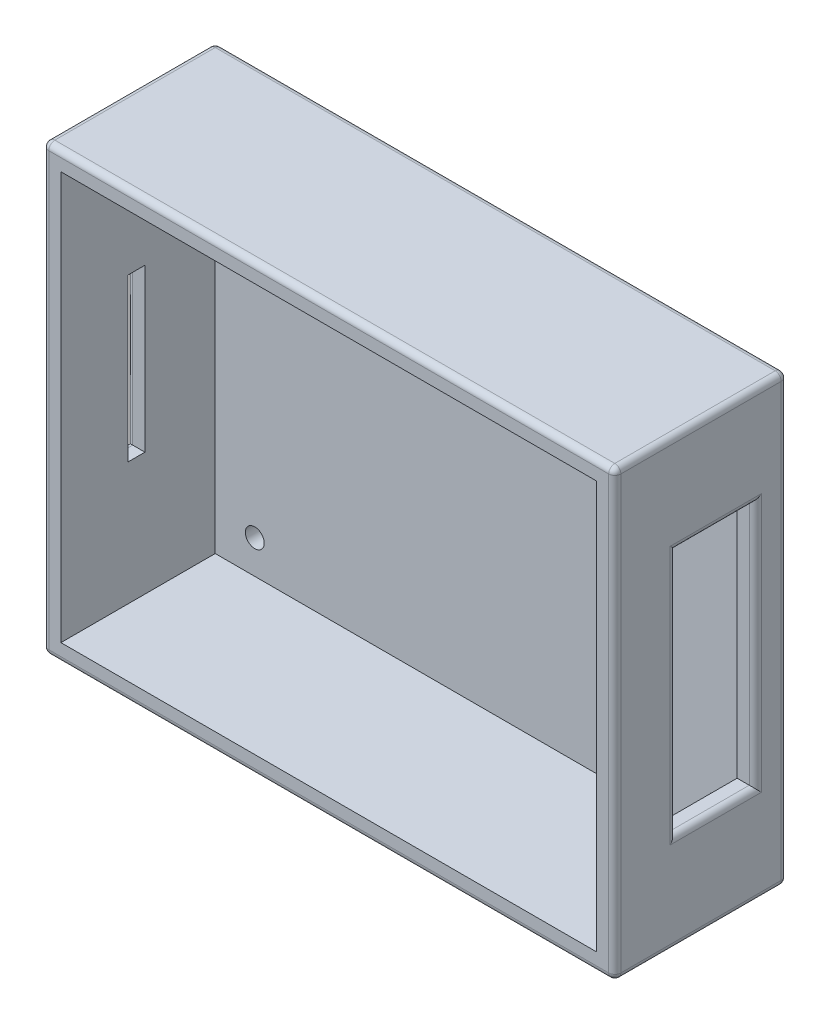
from build123d import *

# Parameters (mm, degrees)
SKETCH_1_W          = 94
SKETCH_1_H          = 73
SKETCH_1_R          = 1.55
EXTRUDE_2_DEPTH     = 28.35
SKETCH_3_W          = 88
SKETCH_3_H          = 67
CUT_EXTRUDE_1_DEPTH = 25.35
SKETCH_4_W          = 13
SKETCH_4_H          = 40.5
CUT_EXTRUDE_3_DEPTH = 3
CHAMFER_1_SIZE      = 2
SKETCH_6_W          = 2.8
SKETCH_6_H          = 26.6
CUT_EXTRUDE_4_DEPTH = 3
FILLET_1_R          = 1
EXTRUDE_3_DEPTH     = 0.8


with BuildPart() as part:
    # Эскиз1 → Бобышка-Вытянуть2 (new body)
    with BuildSketch(Plane.XY):
        with Locations((-0.5, -44.96449166)):
            Rectangle(SKETCH_1_W, SKETCH_1_H)
        with Locations(Location((-38, -16.96449166, 0), (0, 0, 180))):
            Circle(SKETCH_1_R, mode=Mode.SUBTRACT)
        with Locations(Location((38, -16.96449166, 0), (0, 0, 180))):
            Circle(SKETCH_1_R, mode=Mode.SUBTRACT)
        with Locations(Location((38, -72.96449166, 0), (0, 0, 180))):
            Circle(SKETCH_1_R, mode=Mode.SUBTRACT)
        with Locations(Location((-38, -72.96449166, 0), (0, 0, 180))):
            Circle(SKETCH_1_R, mode=Mode.SUBTRACT)
    extrude(amount=EXTRUDE_2_DEPTH)

    # Эскиз3 → Вырез-Вытянуть1 (cut)
    with BuildSketch(Plane.XY.offset(28.35)):
        with Locations((-0.5, -44.96449166)):
            Rectangle(SKETCH_3_W, SKETCH_3_H)
    extrude(amount=-CUT_EXTRUDE_1_DEPTH, mode=Mode.SUBTRACT)

    # Эскиз4 → Вырез-Вытянуть3 (cut)
    with BuildSketch(Plane(origin=(46.5, 0, 0), x_dir=(0, 0, -1), z_dir=(1, 0, 0))):
        with Locations((-11.75, -45.056943797)):
            Rectangle(SKETCH_4_W, SKETCH_4_H)
    extrude(amount=-CUT_EXTRUDE_3_DEPTH, mode=Mode.SUBTRACT)

    # Фаска1
    chamfer_1_edges = [part.edges().sort_by_distance(p)[0] for p in [
        (43.5, -45.056943797, 18.25),
    ]]
    chamfer(chamfer_1_edges, length=CHAMFER_1_SIZE)

    # Эскиз6 → Вырез-Вытянуть4 (cut)
    with BuildSketch(Plane.ZY.offset(47.5)):
        with Locations((15.95, -44.96449166)):
            Rectangle(SKETCH_6_W, SKETCH_6_H)
    extrude(amount=-CUT_EXTRUDE_4_DEPTH, mode=Mode.SUBTRACT)

    # Скругление1
    fillet_1_edges = [part.edges().sort_by_distance(p)[0] for p in [
        (46.5, -8.46449166, 14.175),
        (46.5, -44.96449166, 28.35),
        (-0.5, -8.46449166, 28.35),
        (-47.5, -44.96449166, 28.35),
        (-0.5, -81.46449166, 28.35),
        (46.5, -24.806943797, 11.75),
        (46.5, -45.056943797, 18.25),
        (46.5, -65.306943797, 11.75),
        (46.5, -45.056943797, 5.25),
        (-0.5, -8.46449166, 0),
        (46.5, -44.96449166, 0),
        (46.5, -81.46449166, 14.175),
        (-0.5, -81.46449166, 0),
        (-47.5, -44.96449166, 0),
        (-47.5, -81.46449166, 14.175),
        (-47.5, -44.96449166, 14.55),
        (-47.5, -44.96449166, 17.35),
        (-47.5, -58.26449166, 15.95),
        (-47.5, -31.66449166, 15.95),
        (-47.5, -8.46449166, 14.175),
    ]]
    fillet(fillet_1_edges, radius=FILLET_1_R - 0.0001)  # a hair under: the kernel refuses the full size

    # Эскиз7 → Бобышка-Вытянуть3 (add)
    # profile 1 of 7: a face of its own
    with BuildSketch(Plane.XZ.offset(81.46449166)):
        with BuildLine():
            Line((-25.998738266, 13.421980691), (-24.57628484, 13.580031071))
            Line((-24.57628484, 13.580031071), (-24.593571601, 13.170087897))
            add(Edge.make_bspline(
                [(-24.593571601, 13.170087897), (-24.58918248, 13.058659708), (-24.580492643, 12.83804768), (-24.51479641, 12.515351956), (-24.406526654, 12.207746813), (-24.259983953, 11.914341954), (-24.060535711, 11.642574177), (-23.79948073, 11.406277945), (-23.485459325, 11.200606133), (-23.117333989, 11.032791449), (-22.705690078, 10.89788566), (-22.253564966, 10.802909353), (-21.764933146, 10.746144699), (-21.426960447, 10.738879207), (-21.252287773, 10.73512422)],
                knots=[0, 0, 0, 0, 0.858275681, 1.699264264, 2.525822281, 3.365565876, 4.218149606, 5.107011874, 6.064126396, 7.09998594, 8.215326971, 9.396056326, 10.654217318, 12, 12, 12, 12], degree=3))
            add(Edge.make_bspline(
                [(-21.252287773, 10.73512422), (-21.127925054, 10.736901677), (-20.886236266, 10.740356018), (-20.53485233, 10.770427799), (-20.206316547, 10.818800357), (-19.900607884, 10.887566076), (-19.61851522, 10.977011888), (-19.356718314, 11.082040218), (-19.11886263, 11.210385148), (-18.906509644, 11.359797369), (-18.717818175, 11.519862543), (-18.549850471, 11.684494112), (-18.412249365, 11.858529972), (-18.295768978, 12.035122406), (-18.206235982, 12.219431388), (-18.141752542, 12.40926719), (-18.103145853, 12.605473994), (-18.098544583, 12.737748635), (-18.096219235, 12.804596392)],
                knots=[0, 0, 0, 0, 1.425731279, 2.770792289, 4.04024254, 5.230893421, 6.3592722, 7.430212247, 8.460708778, 9.450459374, 10.401561135, 11.295891975, 12.14200498, 12.940503131, 13.717227411, 14.484314755, 15.234016756, 16, 16, 16, 16], degree=3))
            add(Edge.make_bspline(
                [(-18.096219235, 12.804596392), (-18.101384398, 12.897433587), (-18.111631468, 13.081611548), (-18.196728876, 13.349146236), (-18.327590265, 13.6063769), (-18.453515737, 13.756770317), (-18.518510096, 13.834393403)],
                knots=[0, 0, 0, 0, 0.976847459, 1.937949255, 2.935706458, 4, 4, 4, 4], degree=3))
            add(Edge.make_bspline(
                [(-18.518510096, 13.834393403), (-18.561335789, 13.875664553), (-18.657559858, 13.968395754), (-18.838058598, 14.09923587), (-19.063528076, 14.241996301), (-19.336100961, 14.39427283), (-19.654621195, 14.556148143), (-20.019682532, 14.729302882), (-20.430539491, 14.913738211), (-20.721905424, 15.036824685), (-20.874448582, 15.101265985)],
                knots=[0, 0, 0, 0, 0.53058602, 1.192161577, 1.98540538, 2.9135926, 3.978754358, 5.17558752, 6.521293165, 8, 8, 8, 8], degree=3))
            add(Edge.make_bspline(
                [(-20.874448582, 15.101265985), (-20.993997425, 15.151043715), (-21.223814361, 15.246734859), (-21.552021246, 15.391612868), (-21.853248079, 15.522330729), (-22.121545791, 15.650357228), (-22.362753903, 15.762219172), (-22.571879112, 15.869252373), (-22.753579921, 15.96401851), (-22.861875919, 16.029328585), (-22.91181677, 16.059446417)],
                knots=[0, 0, 0, 0, 1.379339666, 2.651599208, 3.821445283, 4.876640935, 5.817965058, 6.653218182, 7.378929685, 8, 8, 8, 8], degree=3))
            add(Edge.make_bspline(
                [(-22.91181677, 16.059446417), (-23.047460541, 16.148591382), (-23.308158276, 16.319921699), (-23.648139477, 16.616282305), (-23.943603194, 16.912609276), (-24.176088697, 17.23170026), (-24.357630821, 17.565899905), (-24.484095739, 17.922468312), (-24.563539845, 18.300737084), (-24.571981542, 18.561509468), (-24.57628484, 18.694442606)],
                knots=[0, 0, 0, 0, 1.190296613, 2.28766591, 3.304920813, 4.256269293, 5.175634749, 6.087520294, 7.025081087, 8, 8, 8, 8], degree=3))
            add(Edge.make_bspline(
                [(-24.57628484, 18.694442606), (-24.570117834, 18.848037406), (-24.557963109, 19.150761681), (-24.46117021, 19.59319029), (-24.301954406, 20.011666174), (-24.117450126, 20.337966712), (-23.94184151, 20.583005826), (-23.793275735, 20.75674832), (-23.627870217, 20.917289288), (-23.452166479, 21.071549952), (-23.257194536, 21.208301526), (-23.051981782, 21.339250356), (-22.829070739, 21.45312929), (-22.513802014, 21.597017424), (-22.09133403, 21.742211093), (-21.556242759, 21.868234618), (-20.989349793, 21.943251386), (-20.60138023, 21.952147206), (-20.402766977, 21.956701244)],
                knots=[0, 0, 0, 0, 1.238475896, 2.440946701, 3.635078099, 4.839601842, 5.453463916, 6.065850834, 6.681148677, 7.312269075, 7.950065238, 8.600634686, 9.275045789, 9.967691431, 11.396165333, 12.870345012, 14.397835766, 16, 16, 16, 16], degree=3))
            add(Edge.make_bspline(
                [(-20.402766977, 21.956701244), (-20.283352448, 21.955610763), (-20.050014613, 21.953479946), (-19.707282282, 21.927078529), (-19.378119472, 21.889017023), (-19.063315443, 21.831914476), (-18.761927252, 21.760797616), (-18.476049696, 21.671407), (-18.202935712, 21.568670017), (-17.94655436, 21.446619385), (-17.705010247, 21.31372266), (-17.478781074, 21.170754856), (-17.271385246, 21.014697631), (-17.080563872, 20.849012453), (-16.906140591, 20.673183015), (-16.750854988, 20.484970712), (-16.611615629, 20.287040068), (-16.453764599, 20.013159969), (-16.292701843, 19.668073859), (-16.150043943, 19.254460254), (-16.056984902, 18.850056191), (-16.046626827, 18.581309258), (-16.041564287, 18.449958424)],
                knots=[0, 0, 0, 0, 1.143512507, 2.234441106, 3.290654609, 4.316047515, 5.297102877, 6.254749841, 7.183126598, 8.089581974, 8.971812638, 9.822656227, 10.650539834, 11.455310542, 12.241441721, 13.019784509, 13.789735541, 14.55649065, 16.045011508, 17.428866519, 18.743351145, 20, 20, 20, 20], degree=3))
            add(Edge.make_bspline(
                [(-16.041564287, 18.449958424), (-16.041564287, 18.415384903), (-16.041564287, 18.32977428), (-16.041564287, 18.244163658), (-16.041564287, 18.193126555)],
                knots=[0, 0, 0, 0, 0.807692308, 2, 2, 2, 2], degree=3))
            Line((-16.041564287, 18.193126555), (-17.464017713, 18.064710621))
            add(Edge.make_bspline(
                [(-17.464017713, 18.064710621), (-17.464627259, 18.147073655), (-17.465780867, 18.302951469), (-17.483136998, 18.522316963), (-17.510013039, 18.713857327), (-17.542718168, 18.828875729), (-17.557860126, 18.882127433)],
                knots=[0, 0, 0, 0, 1.196373472, 2.264220624, 3.196361544, 4, 4, 4, 4], degree=3))
            add(Edge.make_bspline(
                [(-17.557860126, 18.882127433), (-17.58795316, 18.9652977), (-17.647269929, 19.129235695), (-17.769632787, 19.356943891), (-17.915066898, 19.5638303), (-18.080951829, 19.755318654), (-18.28057915, 19.923940028), (-18.508645928, 20.078777623), (-18.773576352, 20.210948322), (-19.067856831, 20.325521016), (-19.388177693, 20.419754606), (-19.729881776, 20.484249203), (-20.08959815, 20.529071958), (-20.335943709, 20.532495484), (-20.46203587, 20.534247818)],
                knots=[0, 0, 0, 0, 0.88689608, 1.748172411, 2.584840347, 3.421997753, 4.283274084, 5.199961756, 6.182923366, 7.247800225, 8.366915099, 9.5288022, 10.735115532, 12, 12, 12, 12], degree=3))
            add(Edge.make_bspline(
                [(-20.46203587, 20.534247818), (-20.572390792, 20.53221196), (-20.786860586, 20.528255361), (-21.09890774, 20.501709026), (-21.391686188, 20.454318649), (-21.665928814, 20.390857006), (-21.922543812, 20.30957854), (-22.160164017, 20.208498659), (-22.379173408, 20.08809363), (-22.511044533, 19.991552153), (-22.575959711, 19.944028428)],
                knots=[0, 0, 0, 0, 1.185078943, 2.303147281, 3.3596952, 4.367486573, 5.323590023, 6.246379327, 7.136758724, 8, 8, 8, 8], degree=3))
            add(Edge.make_bspline(
                [(-22.575959711, 19.944028428), (-22.622350702, 19.906523912), (-22.713213968, 19.833066056), (-22.829001838, 19.703807004), (-22.932710469, 19.569938914), (-23.009850151, 19.421168344), (-23.076765117, 19.267919253), (-23.119884044, 19.102947613), (-23.147896722, 18.930006401), (-23.151832675, 18.811447871), (-23.153831415, 18.751241962)],
                knots=[0, 0, 0, 0, 1.039030166, 2.035086348, 3.020315512, 3.984274806, 4.949837582, 5.932341348, 6.950010026, 8, 8, 8, 8], degree=3))
            add(Edge.make_bspline(
                [(-23.153831415, 18.751241962), (-23.151136676, 18.679378661), (-23.145847757, 18.538333776), (-23.099376353, 18.332665481), (-23.025062696, 18.138582454), (-22.918999716, 17.952705724), (-22.769774922, 17.775623557), (-22.574700755, 17.60414871), (-22.333476283, 17.433420049), (-22.151442263, 17.331166053), (-22.054887362, 17.276928255)],
                knots=[0, 0, 0, 0, 0.885166844, 1.737301987, 2.585559362, 3.440410528, 4.36313212, 5.426921844, 6.635181999, 8, 8, 8, 8], degree=3))
            add(Edge.make_bspline(
                [(-22.054887362, 17.276928255), (-22.011268002, 17.254686863), (-21.91189615, 17.204017426), (-21.745034978, 17.119463092), (-21.537857896, 17.024361744), (-21.294850319, 16.909172326), (-21.010332094, 16.786370877), (-20.692193773, 16.640113727), (-20.332560365, 16.486387037), (-20.080826974, 16.376544037), (-19.948372133, 16.318747823)],
                knots=[0, 0, 0, 0, 0.507694923, 1.156609942, 1.939357829, 2.871124938, 3.94489054, 5.152129338, 6.501532703, 8, 8, 8, 8], degree=3))
            add(Edge.make_bspline(
                [(-19.948372133, 16.318747823), (-19.840535325, 16.271004969), (-19.632962827, 16.17910589), (-19.334132068, 16.046776814), (-19.06236467, 15.920976288), (-18.817273283, 15.801920879), (-18.597728014, 15.691804463), (-18.404475309, 15.587575431), (-18.237096138, 15.49237928), (-18.135559477, 15.429178487), (-18.088810624, 15.400079986)],
                knots=[0, 0, 0, 0, 1.363402043, 2.62438005, 3.778247165, 4.825290736, 5.77437896, 6.617445503, 7.363453188, 8, 8, 8, 8], degree=3))
            add(Edge.make_bspline(
                [(-18.088810624, 15.400079986), (-17.979831919, 15.325240033), (-17.766027205, 15.178411946), (-17.484093817, 14.918555587), (-17.238777486, 14.638113987), (-17.03518289, 14.332731213), (-16.873447416, 14.005020688), (-16.75629796, 13.655661933), (-16.685266045, 13.284099911), (-16.677653662, 13.02881818), (-16.67376581, 12.898438805)],
                knots=[0, 0, 0, 0, 1.054714124, 2.069237773, 3.052629045, 4.024524991, 4.991873927, 5.962790947, 6.959541516, 8, 8, 8, 8], degree=3))
            add(Edge.make_bspline(
                [(-16.67376581, 12.898438805), (-16.67583304, 12.816053576), (-16.679916722, 12.653306735), (-16.707470336, 12.411178635), (-16.754830671, 12.175310189), (-16.818311382, 11.942359987), (-16.906792327, 11.716898214), (-17.00696482, 11.492765183), (-17.128944419, 11.274986603), (-17.269253162, 11.06429311), (-17.425002555, 10.86040772), (-17.597768805, 10.66905719), (-17.783371924, 10.488409003), (-17.981941239, 10.31863658), (-18.197223218, 10.163461807), (-18.427697525, 10.02113552), (-18.669936656, 9.886532058), (-19.014680659, 9.724907522), (-19.475406534, 9.556868227), (-20.063335125, 9.4141754), (-20.690084109, 9.329838905), (-21.12031729, 9.318494701), (-21.341191112, 9.312670795)],
                knots=[0, 0, 0, 0, 0.753323331, 1.488142895, 2.22477222, 2.951645461, 3.692569589, 4.437003057, 5.195162042, 5.9717794, 6.750145735, 7.539032231, 8.32684067, 9.11716229, 9.925698599, 10.750710093, 11.592951182, 12.45831893, 14.230046657, 16.066640586, 17.980685438, 20, 20, 20, 20], degree=3))
            add(Edge.make_bspline(
                [(-21.341191112, 9.312670795), (-21.508395537, 9.315524732), (-21.835113548, 9.321101334), (-22.313397032, 9.364379083), (-22.76934704, 9.431519267), (-23.201043581, 9.531906041), (-23.611689323, 9.652414479), (-23.994780351, 9.81098295), (-24.357431001, 9.990027725), (-24.695760685, 10.19902915), (-25.002920921, 10.446309146), (-25.270954117, 10.7395702), (-25.496758859, 11.078689324), (-25.67874481, 11.462977463), (-25.822413596, 11.889861113), (-25.924642124, 12.361001264), (-25.986007184, 12.877073402), (-25.994387609, 13.235766784), (-25.998738266, 13.421980691)],
                knots=[0, 0, 0, 0, 1.125067994, 2.198386657, 3.229442192, 4.223907366, 5.179018808, 6.105903256, 7.010179201, 7.898637484, 8.776811776, 9.655143314, 10.561656395, 11.508166035, 12.508477435, 13.586446658, 14.74701564, 16, 16, 16, 16], degree=3))
        make_face()
    # profile 2 of 7: a face of its own
    with BuildSketch(Plane.XZ.offset(81.46449166)):
        with BuildLine():
            Line((-15.251312384, 9.470721176), (-12.722506295, 21.798650863))
            Line((-12.722506295, 21.798650863), (-9.03548726, 21.798650863))
            add(Edge.make_bspline(
                [(-9.03548726, 21.798650863), (-8.928464532, 21.798427102), (-8.720131306, 21.797991521), (-8.417976135, 21.787471392), (-8.134757118, 21.772674565), (-7.871901857, 21.754065194), (-7.628015632, 21.726983258), (-7.404131009, 21.69212949), (-7.198723164, 21.653743238), (-7.069602785, 21.62143959), (-7.007997221, 21.606026962)],
                knots=[0, 0, 0, 0, 1.257793568, 2.448453687, 3.552935844, 4.591055517, 5.545164475, 6.435952274, 7.253765793, 8, 8, 8, 8], degree=3))
            add(Edge.make_bspline(
                [(-7.007997221, 21.606026962), (-6.846038053, 21.558200667), (-6.526373624, 21.46380425), (-6.077092012, 21.253822136), (-5.665732195, 20.991640735), (-5.292109675, 20.681736386), (-4.956005228, 20.327340454), (-4.667123425, 19.92669712), (-4.419778038, 19.485522674), (-4.222621533, 19.002469272), (-4.064445097, 18.485884507), (-3.951221244, 17.937885645), (-3.883782458, 17.359297722), (-3.875781855, 16.963481104), (-3.871684981, 16.760794981)],
                knots=[0, 0, 0, 0, 0.971686536, 1.917851432, 2.845211268, 3.77470219, 4.707187738, 5.650889975, 6.612528642, 7.613753951, 8.650188786, 9.720560168, 10.832765474, 12, 12, 12, 12], degree=3))
            add(Edge.make_bspline(
                [(-3.871684981, 16.760794981), (-3.876507432, 16.518528283), (-3.885969468, 16.04318161), (-3.972007304, 15.346504097), (-4.111962067, 14.681968567), (-4.307863094, 14.052398459), (-4.548679787, 13.45945273), (-4.82334425, 12.901380791), (-5.131519811, 12.378510865), (-5.474283928, 11.897903676), (-5.834827426, 11.459476928), (-6.208763148, 11.070571992), (-6.589552652, 10.729150826), (-6.984612012, 10.436405011), (-7.400862547, 10.183786871), (-7.851886425, 9.975654322), (-8.336115013, 9.795573466), (-8.676478202, 9.708040514), (-8.85027197, 9.663345077)],
                knots=[0, 0, 0, 0, 1.243564061, 2.439972323, 3.598106692, 4.726494165, 5.820661217, 6.881137922, 7.917759965, 8.933410196, 9.909190727, 10.82992683, 11.701160951, 12.532175578, 13.351312929, 14.196535421, 15.079128076, 16, 16, 16, 16], degree=3))
            add(Edge.make_bspline(
                [(-8.85027197, 9.663345077), (-8.993139181, 9.633175035), (-9.293530288, 9.569739821), (-9.772806208, 9.5155752), (-10.298414022, 9.476563832), (-10.664470342, 9.472724923), (-10.855536174, 9.470721176)],
                knots=[0, 0, 0, 0, 0.86763303, 1.824276153, 2.864364682, 4, 4, 4, 4], degree=3))
            Line((-10.855536174, 9.470721176), (-15.251312384, 9.470721176))
        make_face()
        with BuildLine():
            Line((-13.512758198, 10.893174601), (-11.477859547, 10.893174601))
            add(Edge.make_bspline(
                [(-11.477859547, 10.893174601), (-11.254738539, 10.894930397), (-10.820637942, 10.898346446), (-10.188929196, 10.928746884), (-9.59549966, 10.97556768), (-9.214761081, 11.026555517), (-9.030548185, 11.051224982)],
                knots=[0, 0, 0, 0, 1.090787451, 2.122218288, 3.091472141, 4, 4, 4, 4], degree=3))
            add(Edge.make_bspline(
                [(-9.030548185, 11.051224982), (-8.92316917, 11.078731805), (-8.713891818, 11.132341489), (-8.414648857, 11.23224141), (-8.140219818, 11.353430589), (-7.97198166, 11.450628665), (-7.889622, 11.498211214)],
                knots=[0, 0, 0, 0, 1.080723132, 2.106285617, 3.072947104, 4, 4, 4, 4], degree=3))
            add(Edge.make_bspline(
                [(-7.889622, 11.498211214), (-7.787039922, 11.564673208), (-7.579294536, 11.699269549), (-7.289300315, 11.937947499), (-7.012970829, 12.20603281), (-6.844308473, 12.403126248), (-6.758573964, 12.503312854)],
                knots=[0, 0, 0, 0, 0.964340652, 1.952946598, 2.95944109, 4, 4, 4, 4], degree=3))
            add(Edge.make_bspline(
                [(-6.758573964, 12.503312854), (-6.650621255, 12.643913343), (-6.432972388, 12.927385034), (-6.152275105, 13.388191606), (-5.899934063, 13.874972232), (-5.685166951, 14.392552113), (-5.507032641, 14.943071509), (-5.382339762, 15.531272682), (-5.307593539, 16.155460492), (-5.298694241, 16.583599213), (-5.294138406, 16.802777114)],
                knots=[0, 0, 0, 0, 0.917603284, 1.850025965, 2.790176896, 3.755450516, 4.749260533, 5.782929189, 6.865010567, 8, 8, 8, 8], degree=3))
            add(Edge.make_bspline(
                [(-5.294138406, 16.802777114), (-5.296427771, 16.924633998), (-5.300872052, 17.161191457), (-5.323868956, 17.505332606), (-5.369644907, 17.826579982), (-5.427187599, 18.127569875), (-5.505513745, 18.406121647), (-5.603445156, 18.662095163), (-5.712524411, 18.898993556), (-5.845213791, 19.111208431), (-5.990001275, 19.304475032), (-6.141502328, 19.483100589), (-6.306815137, 19.64158711), (-6.478167588, 19.785204909), (-6.66136692, 19.910165773), (-6.853177084, 20.017974997), (-7.054238699, 20.111291008), (-7.194348659, 20.157738974), (-7.264829089, 20.181103999)],
                knots=[0, 0, 0, 0, 1.386912792, 2.692376109, 3.921783691, 5.077346083, 6.177512153, 7.209226048, 8.193939833, 9.140254091, 10.050793655, 10.94086466, 11.802073786, 12.653651001, 13.482512612, 14.321423948, 15.155614895, 16, 16, 16, 16], degree=3))
            add(Edge.make_bspline(
                [(-7.264829089, 20.181103999), (-7.321429197, 20.197533104), (-7.441000522, 20.232240633), (-7.634360009, 20.270437928), (-7.848815149, 20.301570155), (-8.085174368, 20.328745917), (-8.343697972, 20.351302818), (-8.624617958, 20.364660175), (-8.927564149, 20.375712912), (-9.136726122, 20.376031772), (-9.245397921, 20.376197438)],
                knots=[0, 0, 0, 0, 0.708240516, 1.496203126, 2.366716291, 3.313120317, 4.356013468, 5.48572228, 6.693686623, 8, 8, 8, 8], degree=3))
            Line((-9.245397921, 20.376197438), (-11.566762886, 20.376197438))
            Line((-11.566762886, 20.376197438), (-13.512758198, 10.893174601))
        make_face(mode=Mode.SUBTRACT)
    # profile 3 of 7: a face of its own
    with BuildSketch(Plane.XZ.offset(81.46449166)):
        with BuildLine():
            Line((-3.081433078, 9.470721176), (-1.18482851, 18.47959287))
            Line((-1.18482851, 18.47959287), (0.262320287, 18.47959287))
            Line((0.262320287, 18.47959287), (-0.169848722, 16.931193048))
            add(Edge.make_bspline(
                [(-0.169848722, 16.931193048), (-0.049613739, 17.068484066), (0.179939934, 17.330601268), (0.53374365, 17.683087102), (0.876833515, 17.979411128), (1.212176195, 18.22033835), (1.544928645, 18.408060543), (1.880197488, 18.540730152), (2.220249236, 18.620450404), (2.448284678, 18.631940619), (2.561459418, 18.637643251)],
                knots=[0, 0, 0, 0, 1.317415746, 2.515221578, 3.602797499, 4.587383949, 5.492011979, 6.354026978, 7.183098174, 8, 8, 8, 8], degree=3))
            add(Edge.make_bspline(
                [(2.561459418, 18.637643251), (2.641386251, 18.635538163), (2.809957186, 18.631098395), (3.074596, 18.599049208), (3.364707314, 18.549602045), (3.565125106, 18.503684951), (3.670281619, 18.47959287)],
                knots=[0, 0, 0, 0, 0.854454067, 1.802099686, 2.846791343, 4, 4, 4, 4], degree=3))
            Line((3.670281619, 18.47959287), (3.05289732, 17.057139445))
            add(Edge.make_bspline(
                [(3.05289732, 17.057139445), (2.988863128, 17.12915706), (2.867735635, 17.265386049), (2.653837223, 17.416206882), (2.429539667, 17.514407327), (2.273464855, 17.525688878), (2.195967912, 17.531290587)],
                knots=[0, 0, 0, 0, 1.139610882, 2.155695371, 3.084234231, 4, 4, 4, 4], degree=3))
            add(Edge.make_bspline(
                [(2.195967912, 17.531290587), (2.129017012, 17.528542062), (1.992683106, 17.522945169), (1.789291668, 17.472688131), (1.58360211, 17.394962455), (1.376507391, 17.284738461), (1.166199402, 17.145227952), (0.952803532, 16.976164347), (0.73848399, 16.774435926), (0.51927491, 16.542602329), (0.30541318, 16.268866176), (0.102395692, 15.94701728), (-0.088109543, 15.575769205), (-0.270621802, 15.156601515), (-0.443489701, 14.689281285), (-0.600920984, 14.171982649), (-0.756829055, 13.608008048), (-0.843473598, 13.212538514), (-0.888484047, 13.007098442)],
                knots=[0, 0, 0, 0, 0.549463368, 1.118886924, 1.711931635, 2.353427189, 3.042026111, 3.783708105, 4.587857209, 5.458936652, 6.403515595, 7.437581918, 8.58132111, 9.829397418, 11.192852412, 12.673529843, 14.271952167, 16, 16, 16, 16], degree=3))
            Line((-0.888484047, 13.007098442), (-1.631814743, 9.470721176))
            Line((-1.631814743, 9.470721176), (-3.081433078, 9.470721176))
        make_face()
    # profile 4 of 7: a face of its own
    with BuildSketch(Plane.XZ.offset(81.46449166)):
        Polygon((4.685261407, 20.376197438), (4.979136334, 21.798650863), (6.426285131, 21.798650863), (6.134879742, 20.376197438), align=None)
    # profile 5 of 7: a face of its own
    with BuildSketch(Plane.XZ.offset(81.46449166)):
        Polygon((2.450330244, 9.470721176), (4.300013604, 18.47959287), (5.744692865, 18.47959287), (3.897479041, 9.470721176), align=None)
    # profile 6 of 7: a face of its own
    with BuildSketch(Plane.XZ.offset(81.46449166)):
        with BuildLine():
            Line((8.653807683, 9.470721176), (7.191841662, 18.47959287))
            Line((7.191841662, 18.47959287), (8.629112311, 18.47959287))
            Line((8.629112311, 18.47959287), (9.347747635, 13.488658195))
            add(Edge.make_bspline(
                [(9.347747635, 13.488658195), (9.358741278, 13.414611933), (9.382166154, 13.2568367), (9.41333444, 13.003048742), (9.448499446, 12.718390513), (9.482337511, 12.400457404), (9.519482035, 12.050618471), (9.558717681, 11.667810751), (9.60146158, 11.2530814), (9.627910261, 10.965641805), (9.641622561, 10.816618948)],
                knots=[0, 0, 0, 0, 0.668244214, 1.42387184, 2.282503407, 3.228742691, 4.278059607, 5.423155865, 6.664036961, 8, 8, 8, 8], degree=3))
            add(Edge.make_bspline(
                [(9.641622561, 10.816618948), (9.717563072, 10.983187118), (9.875825899, 11.33032133), (10.135169992, 11.865935331), (10.427429588, 12.435231441), (10.633942216, 12.825404662), (10.740566614, 13.026854739)],
                knots=[0, 0, 0, 0, 0.889762753, 1.854298405, 2.892154233, 4, 4, 4, 4], degree=3))
            Line((10.740566614, 13.026854739), (13.671907267, 18.47959287))
            Line((13.671907267, 18.47959287), (15.257350147, 18.47959287))
            Line((15.257350147, 18.47959287), (10.342971125, 9.470721176))
            Line((10.342971125, 9.470721176), (8.653807683, 9.470721176))
        make_face()
    # profile 7 of 7: a face of its own
    with BuildSketch(Plane.XZ.offset(81.46449166)):
        with BuildLine():
            Line((21.302777206, 12.473678407), (22.769682301, 12.315628027))
            add(Edge.make_bspline(
                [(22.769682301, 12.315628027), (22.74099773, 12.226062425), (22.683075979, 12.045205735), (22.56187201, 11.782191003), (22.415022592, 11.523601849), (22.246872468, 11.264922987), (22.051404948, 11.010456615), (21.827457026, 10.761511882), (21.580710561, 10.514381688), (21.310998335, 10.274417714), (21.02429285, 10.047064457), (20.715779175, 9.85153423), (20.394664744, 9.686513693), (20.060619908, 9.548348954), (19.71215668, 9.443241665), (19.349740563, 9.365740695), (18.973482783, 9.321126654), (18.718110312, 9.315513859), (18.588755826, 9.312670795)],
                knots=[0, 0, 0, 0, 0.821440156, 1.658705401, 2.525323128, 3.419405186, 4.353419828, 5.32681938, 6.344399772, 7.404443113, 8.481060479, 9.538977106, 10.591299887, 11.633537695, 12.694215778, 13.768160887, 14.869500701, 16, 16, 16, 16], degree=3))
            add(Edge.make_bspline(
                [(18.588755826, 9.312670795), (18.427897125, 9.318704312), (18.109735932, 9.330637959), (17.642561858, 9.415475119), (17.196390319, 9.560632869), (16.774838572, 9.760001678), (16.384380614, 10.011531573), (16.046380187, 10.327053464), (15.750411747, 10.686833538), (15.512564804, 11.10048308), (15.324846012, 11.553149575), (15.193290731, 12.040555206), (15.108808071, 12.557182057), (15.099248027, 12.912092895), (15.094360692, 13.093532244)],
                knots=[0, 0, 0, 0, 0.998551589, 1.975027533, 2.936744805, 3.903838964, 4.863557655, 5.807675034, 6.763178998, 7.745855275, 8.758641806, 9.797744155, 10.874151411, 12, 12, 12, 12], degree=3))
            add(Edge.make_bspline(
                [(15.094360692, 13.093532244), (15.09604614, 13.214616769), (15.099422987, 13.457213409), (15.133459526, 13.819056584), (15.184188826, 14.178841631), (15.259609656, 14.534653656), (15.352703398, 14.888814727), (15.469420501, 15.238844778), (15.605942755, 15.586859315), (15.762652596, 15.928931009), (15.935168679, 16.259595751), (16.124907209, 16.568871675), (16.321187243, 16.859793269), (16.53344457, 17.126430754), (16.759916004, 17.369662532), (16.996604879, 17.591729102), (17.244506095, 17.794269086), (17.507162008, 17.970944811), (17.777184705, 18.128006702), (18.052912254, 18.26574631), (18.335767546, 18.379190166), (18.623944013, 18.472283767), (18.916384639, 18.547968727), (19.214640949, 18.598727181), (19.518156928, 18.632724531), (19.723003107, 18.63599763), (19.825993962, 18.637643251)],
                knots=[0, 0, 0, 0, 1.075906032, 2.155611451, 3.227554832, 4.30373447, 5.38628686, 6.480642286, 7.581143633, 8.707391042, 9.82337293, 10.893692135, 11.930684225, 12.940768785, 13.919223559, 14.881988069, 15.823529777, 16.761054785, 17.692163021, 18.598508727, 19.497917784, 20.397951545, 21.288749041, 22.180057169, 23.084984307, 24, 24, 24, 24], degree=3))
            add(Edge.make_bspline(
                [(19.825993962, 18.637643251), (19.955387958, 18.635163428), (20.207669795, 18.630328472), (20.576427184, 18.581928183), (20.924715322, 18.503884846), (21.253513103, 18.393655265), (21.564501363, 18.257241276), (21.851803647, 18.081568611), (22.120148467, 17.878273037), (22.367068533, 17.645917266), (22.590355653, 17.386865108), (22.781700247, 17.100874539), (22.950407679, 16.795947012), (23.082390647, 16.465152569), (23.186465254, 16.112940308), (23.259898189, 15.737606089), (23.304893371, 15.340266342), (23.310246499, 15.067637298), (23.312980484, 14.928398381)],
                knots=[0, 0, 0, 0, 1.079196217, 2.10412856, 3.097265039, 4.052997914, 4.993829394, 5.924450447, 6.855882321, 7.798592485, 8.748507102, 9.702980304, 10.665060364, 11.651045023, 12.668191174, 13.725659051, 14.838433479, 16, 16, 16, 16], degree=3))
            add(Edge.make_bspline(
                [(23.312980484, 14.928398381), (23.30749822, 14.706588067), (23.296331419, 14.254783511), (23.230449754, 13.807648333), (23.196912236, 13.580031071)],
                knots=[0, 0, 0, 0, 0.981886135, 2, 2, 2, 2], degree=3))
            Line((23.196912236, 13.580031071), (16.674864499, 13.580031071))
            add(Edge.make_bspline(
                [(16.674864499, 13.580031071), (16.650921394, 13.536015538), (16.605781083, 13.453032365), (16.554511251, 13.326848012), (16.523541828, 13.206989698), (16.518972744, 13.128258568), (16.516814118, 13.091062706)],
                knots=[0, 0, 0, 0, 1.156942796, 2.181202349, 3.140724307, 4, 4, 4, 4], degree=3))
            add(Edge.make_bspline(
                [(16.516814118, 13.091062706), (16.518767817, 12.985633506), (16.522559889, 12.780998464), (16.550122797, 12.483999805), (16.593788289, 12.205606664), (16.656509239, 11.946341412), (16.74254621, 11.70784424), (16.840421429, 11.485870348), (16.957997447, 11.282383582), (17.09817138, 11.102836092), (17.247768379, 10.941346849), (17.409522345, 10.804022681), (17.575341803, 10.682716101), (17.752115099, 10.5856216), (17.937759872, 10.512658376), (18.130023379, 10.456672167), (18.330802927, 10.424087897), (18.467632834, 10.420725494), (18.536895545, 10.419023459)],
                knots=[0, 0, 0, 0, 1.346284225, 2.613098929, 3.805631801, 4.942804233, 6.013450698, 7.039235158, 8.038108926, 9.00533571, 9.942442562, 10.84439418, 11.710848438, 12.56244313, 13.41163356, 14.253504373, 15.115931414, 16, 16, 16, 16], degree=3))
            add(Edge.make_bspline(
                [(18.536895545, 10.419023459), (18.67013376, 10.424747577), (18.938818483, 10.436290684), (19.335600485, 10.546542689), (19.731201753, 10.709254168), (20.04701159, 10.903196635), (20.29577849, 11.082691592), (20.469751425, 11.240295535), (20.637681921, 11.408288887), (20.791438253, 11.594231148), (20.938791562, 11.791511568), (21.071338212, 12.005625334), (21.196257602, 12.232277635), (21.266923932, 12.392425683), (21.302777206, 12.473678407)],
                knots=[0, 0, 0, 0, 1.313044299, 2.647851039, 4.03980324, 5.527339259, 6.29475363, 7.066375866, 7.842396062, 8.63863277, 9.446691243, 10.272184996, 11.123375662, 12, 12, 12, 12], degree=3))
        make_face()
        with BuildLine():
            Line((16.916879144, 14.686383736), (21.883118447, 14.686383736))
            add(Edge.make_bspline(
                [(21.883118447, 14.686383736), (21.88489191, 14.757174562), (21.887861285, 14.875702226), (21.889761678, 14.994251536), (21.890527059, 15.041997092)],
                knots=[0, 0, 0, 0, 1.194503009, 2, 2, 2, 2], degree=3))
            add(Edge.make_bspline(
                [(21.890527059, 15.041997092), (21.888218192, 15.139165186), (21.883710403, 15.328874356), (21.860736518, 15.604896978), (21.815337119, 15.863075438), (21.755218237, 16.104366018), (21.672025614, 16.326447362), (21.577800092, 16.53374214), (21.459111045, 16.720245615), (21.326862465, 16.889935737), (21.180512003, 17.041662543), (21.022992713, 17.172412294), (20.854415388, 17.282488013), (20.677318926, 17.375030395), (20.48725458, 17.442894046), (20.28945614, 17.49633208), (20.080410889, 17.525662702), (19.93802994, 17.529391354), (19.865506557, 17.531290587)],
                knots=[0, 0, 0, 0, 1.288915635, 2.516454775, 3.668675548, 4.762204166, 5.808675246, 6.809806692, 7.776046417, 8.732555008, 9.659000055, 10.566141369, 11.441184925, 12.324901883, 13.209090714, 14.112018255, 15.038334656, 16, 16, 16, 16], degree=3))
            add(Edge.make_bspline(
                [(19.865506557, 17.531290587), (19.785494872, 17.529949563), (19.62715741, 17.527295772), (19.392930606, 17.488986584), (19.162771347, 17.437491618), (18.939879294, 17.355757507), (18.721296018, 17.2571159), (18.50760305, 17.136416973), (18.303296278, 16.987584461), (18.100173529, 16.824033244), (17.906457863, 16.635638345), (17.727827093, 16.422269143), (17.557230637, 16.18969315), (17.407008609, 15.93082471), (17.260744498, 15.65421391), (17.135290742, 15.351021733), (17.014360476, 15.028405923), (16.949873088, 14.802146012), (16.916879144, 14.686383736)],
                knots=[0, 0, 0, 0, 0.867869597, 1.717452491, 2.571772394, 3.425671253, 4.289803496, 5.174634535, 6.084973587, 7.031591473, 8.005136717, 9.013559597, 10.050697067, 11.133079613, 12.260592687, 13.446148552, 14.693362615, 16, 16, 16, 16], degree=3))
        make_face(mode=Mode.SUBTRACT)
    extrude(amount=EXTRUDE_3_DEPTH)


solid = part.part
